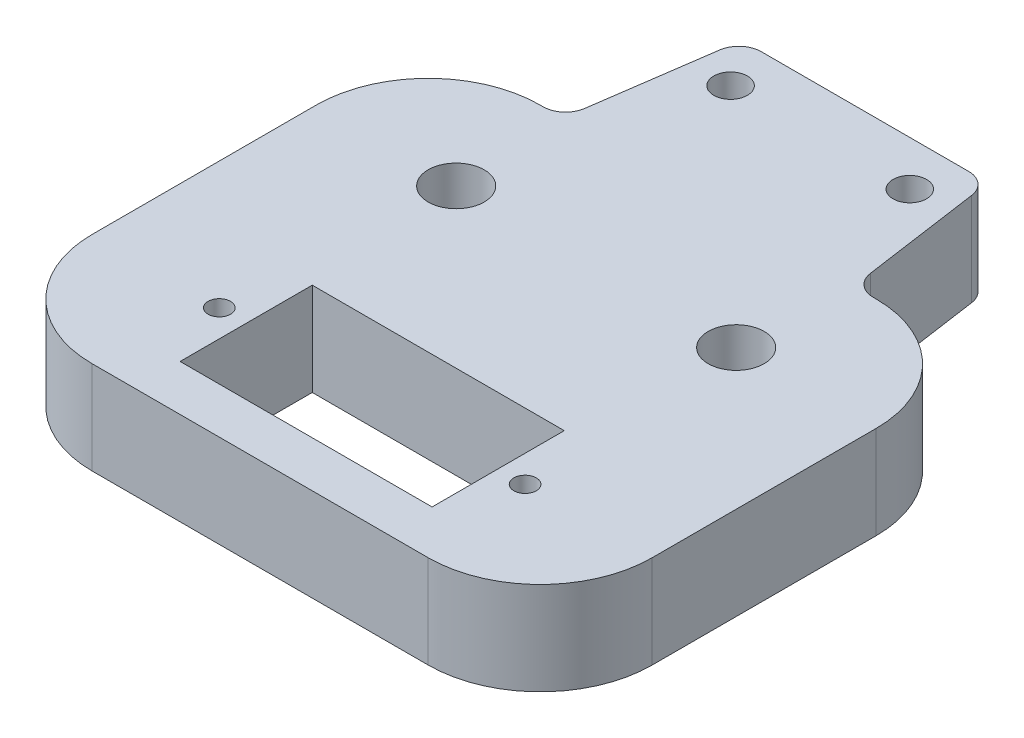
from build123d import *

# Parameters (mm, degrees)
SKETCH1_R           = 1
SKETCH1_W           = 22.5
SKETCH1_H           = 11.8
SKETCH1_R_2         = 2.5
SKETCH1_R_3         = 1.5
BOSS_EXTRUDE1_DEPTH = 8.3
FILLET1_R           = 2


with BuildPart() as part:
    # Sketch1 → Boss-Extrude1 (new body)
    with BuildSketch(Plane(origin=(0, 0, 0), x_dir=(1, 0, 0), z_dir=(0, 1, 0))):
        with BuildLine():
            Line((-13, 20), (-15, 20))
            ThreePointArc((-15, 20), (-22.071067812, 17.071067812), (-25, 10))
            Line((-25, 10), (-25, -10))
            ThreePointArc((-25, -10), (-22.071067812, -17.071067812), (-15, -20))
            Line((-15, -20), (15, -20))
            ThreePointArc((15, -20), (22.071067812, -17.071067812), (25, -10))
            Line((25, -10), (25, 10))
            ThreePointArc((25, 10), (22.071067812, 17.071067812), (15, 20))
            Line((15, 20), (13, 20))
            Line((13, 20), (11, 34))
            Line((11, 34), (-11, 34))
            Line((-11, 34), (-13, 20))
        make_face()
        with Locations((-13.65, -10)):
            Circle(SKETCH1_R, mode=Mode.SUBTRACT)
        with Locations((0, -10)):
            Rectangle(SKETCH1_W, SKETCH1_H, mode=Mode.SUBTRACT)
        with Locations((13.65, -10)):
            Circle(SKETCH1_R, mode=Mode.SUBTRACT)
        with Locations((-12.5, 10)):
            Circle(SKETCH1_R_2, mode=Mode.SUBTRACT)
        with Locations((-8, 30)):
            Circle(SKETCH1_R_3, mode=Mode.SUBTRACT)
        with Locations((12.5, 10)):
            Circle(SKETCH1_R_2, mode=Mode.SUBTRACT)
        with Locations((8, 30)):
            Circle(SKETCH1_R_3, mode=Mode.SUBTRACT)
    extrude(amount=BOSS_EXTRUDE1_DEPTH)

    # Fillet1
    fillet1_edges = [part.edges().sort_by_distance(p)[0] for p in [
        (13, 4.15, -20),
        (11, 4.15, -34),
        (-13, 4.15, -20),
        (-11, 4.15, -34),
    ]]
    fillet(fillet1_edges, radius=FILLET1_R)


solid = part.part
